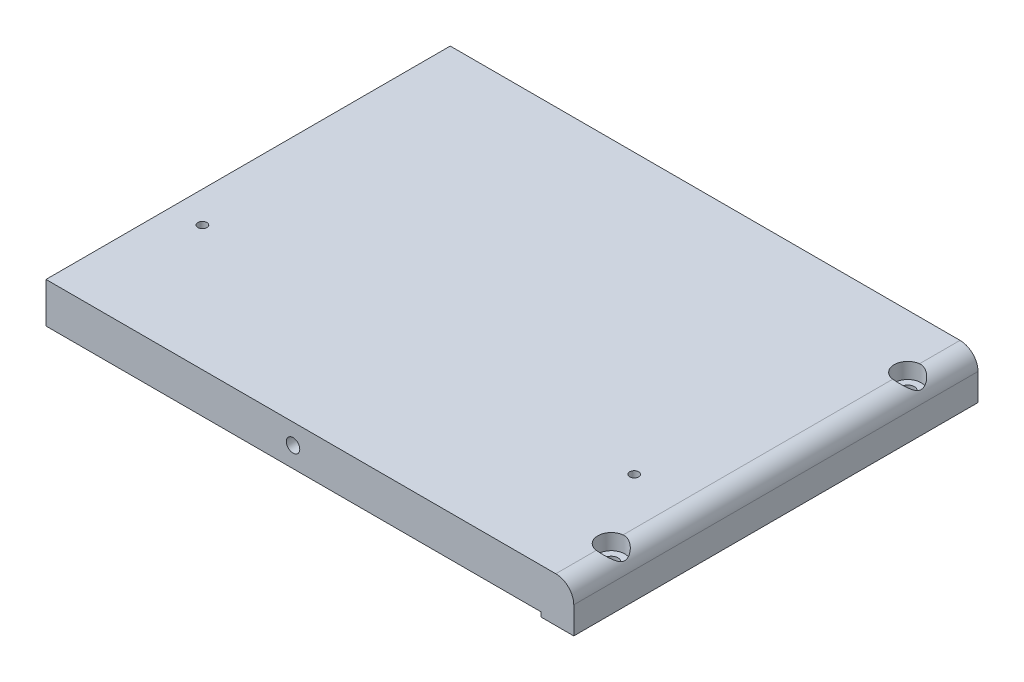
from build123d import *

# Parameters (mm, degrees)
SKETCH_1_W          = 125
SKETCH_1_H          = 70
EXTRUDE_1_DEPTH     = 5
SKETCH_2_W          = 7.5
SKETCH_2_H          = 5
CUT_EXTRUDE_1_DEPTH = 70
EXTRUDE_START       = -70
EXTRUDE_2_DEPTH     = 70
CUT_EXTRUDE_2_REACH = 145.713
SKETCH_5_R          = 11.2
EXTRUDE_3_DEPTH     = 20
SKETCH_7_R          = 1.5
CUT_EXTRUDE_3_DEPTH = 10
CUT_EXTRUDE_4_REACH = 146.193
SKETCH_8_R          = 1.5
SKETCH_9_R          = 3
SKETCH_9_R_2        = 1.5
CUT_EXTRUDE_5_DEPTH = 3.5
SKETCH_11_R         = 1.5
CUT_EXTRUDE_6_DEPTH = 10
CUT_EXTRUDE_7_REACH = 146.193
SKETCH_12_R         = 1
FILLET_1_R          = 4
SKETCH_14_R         = 1.5
CUT_EXTRUDE_8_DEPTH = 10


# Read off the part's stored shape, not the designer's step: 凸台-拉伸2
with BuildPart() as part:
    # 草图1 → 凸台-拉伸1 (new body)
    with BuildSketch(Plane(origin=(0, 0, 0), x_dir=(1, 0, 0), z_dir=(0, 1, 0))):
        with Locations((62.5, 35)):
            Rectangle(SKETCH_1_W, SKETCH_1_H)
    extrude(amount=EXTRUDE_1_DEPTH)

    # 草图2 → 切除-拉伸1 (cut)
    with BuildSketch(Plane.XY):
        with Locations((3.75, 2.5)):
            Rectangle(SKETCH_2_W, SKETCH_2_H)
    extrude(amount=-CUT_EXTRUDE_1_DEPTH, mode=Mode.SUBTRACT)

    # 凸台-拉伸2 outline → 凸台-拉伸2 (add)
    with BuildSketch(Plane.XY.offset(EXTRUDE_START)):
        with BuildLine():
            Line((125, -5), (125, 0))
            Line((125, 0), (7.5, 0))
            Line((7.5, 0), (7.500013395, -11.329987981))
            Line((7.500013395, -11.329987981), (8.200014526, -11.329987981))
            ThreePointArc((8.200014526, -11.329987981), (18.500017961, -4.191325734), (28.800021395, -11.329987981))
            Line((28.800021395, -11.329987981), (30.200014526, -11.329987981))
            ThreePointArc((30.200014526, -11.329987981), (40.500017961, -4.191325734), (50.800021395, -11.329987981))
            Line((50.800021395, -11.329987981), (52.200014526, -11.329987981))
            ThreePointArc((52.200014526, -11.329987981), (62.500017961, -4.191325734), (72.800021395, -11.329987981))
            Line((72.800021395, -11.329987981), (74.200014526, -11.329987981))
            ThreePointArc((74.200014526, -11.329987981), (84.500017961, -4.191325734), (94.800021395, -11.329987981))
            Line((94.800021395, -11.329987981), (96.200014526, -11.329987981))
            ThreePointArc((96.200014526, -11.329987981), (102.083615638, -5.116833662), (110.639689418, -5))
            Line((110.639689418, -5), (125, -5))
        make_face()
    extrude(amount=EXTRUDE_2_DEPTH)

    # 草图5 → 切除-拉伸2 (cut, up to next)
    with BuildSketch(Plane.XY, mode=Mode.PRIVATE) as cut_extrude_2_sk1:
        with Locations((18.500017961, -15.191325734)):
            Circle(SKETCH_5_R)
    cut_extrude_2_tool1 = extrude(cut_extrude_2_sk1.sketch, amount=-CUT_EXTRUDE_2_REACH, mode=Mode.PRIVATE) & part.part
    # 草图5 → 切除-拉伸2 (cut, up to next)
    with BuildSketch(Plane.XY, mode=Mode.PRIVATE) as cut_extrude_2_sk2:
        with Locations((40.500017961, -15.191325734)):
            Circle(SKETCH_5_R)
    cut_extrude_2_tool2 = extrude(cut_extrude_2_sk2.sketch, amount=-CUT_EXTRUDE_2_REACH, mode=Mode.PRIVATE) & part.part
    # 草图5 → 切除-拉伸2 (cut, up to next)
    with BuildSketch(Plane.XY, mode=Mode.PRIVATE) as cut_extrude_2_sk3:
        with Locations((62.500017961, -15.191325734)):
            Circle(SKETCH_5_R)
    cut_extrude_2_tool3 = extrude(cut_extrude_2_sk3.sketch, amount=-CUT_EXTRUDE_2_REACH, mode=Mode.PRIVATE) & part.part
    # 草图5 → 切除-拉伸2 (cut, up to next)
    with BuildSketch(Plane.XY, mode=Mode.PRIVATE) as cut_extrude_2_sk4:
        with Locations((84.500017961, -15.191325734)):
            Circle(SKETCH_5_R)
    cut_extrude_2_tool4 = extrude(cut_extrude_2_sk4.sketch, amount=-CUT_EXTRUDE_2_REACH, mode=Mode.PRIVATE) & part.part
    # 草图5 → 切除-拉伸2 (cut, up to next)
    with BuildSketch(Plane.XY, mode=Mode.PRIVATE) as cut_extrude_2_sk5:
        with Locations((106.500017961, -15.191325734)):
            Circle(SKETCH_5_R)
    cut_extrude_2_tool5 = extrude(cut_extrude_2_sk5.sketch, amount=-CUT_EXTRUDE_2_REACH, mode=Mode.PRIVATE) & part.part
    add(cut_extrude_2_tool1.solids().sort_by_distance((18.500018, -15.191326, 0))[0], mode=Mode.SUBTRACT)
    add(cut_extrude_2_tool2.solids().sort_by_distance((40.500018, -15.191326, 0))[0], mode=Mode.SUBTRACT)
    add(cut_extrude_2_tool3.solids().sort_by_distance((62.500018, -15.191326, 0))[0], mode=Mode.SUBTRACT)
    add(cut_extrude_2_tool4.solids().sort_by_distance((84.500018, -15.191326, 0))[0], mode=Mode.SUBTRACT)
    add(cut_extrude_2_tool5.solids().sort_by_distance((106.500018, -15.191326, 0))[0], mode=Mode.SUBTRACT)

    # 草图6 → 凸台-拉伸3 (add)
    with BuildSketch(Plane.XY):
        Polygon((7.5, 5), (125, 5), (125, -3.991325734), (125, -5), (117.700017961, -5), (117.700017961, -3.991325734), (7.5, -3.991325734), align=None)
    extrude(amount=EXTRUDE_3_DEPTH)

    # 草图7 → 切除-拉伸3 (cut)
    with BuildSketch(Plane(origin=(0, 0, -70), x_dir=(-1, 0, 0), z_dir=(0, 0, -1))):
        with Locations((-29.49999102, -1)):
            Circle(SKETCH_7_R)
        with Locations((-95.50000898, -1)):
            Circle(SKETCH_7_R)
    extrude(amount=-CUT_EXTRUDE_3_DEPTH, mode=Mode.SUBTRACT)

    # 草图8 → 切除-拉伸4 (cut, up to next)
    with BuildSketch(Plane(origin=(0, 5, 0), x_dir=(1, 0, 0), z_dir=(0, 1, 0)), mode=Mode.PRIVATE) as cut_extrude_4_sk1:
        with Locations(Location((121.35000898, 58, 0), (0, 0, 270))):
            Circle(SKETCH_8_R)
    cut_extrude_4_tool1 = extrude(cut_extrude_4_sk1.sketch, amount=-CUT_EXTRUDE_4_REACH, mode=Mode.PRIVATE) & part.part
    # 草图8 → 切除-拉伸4 (cut, up to next)
    with BuildSketch(Plane(origin=(0, 5, 0), x_dir=(1, 0, 0), z_dir=(0, 1, 0)), mode=Mode.PRIVATE) as cut_extrude_4_sk2:
        with Locations(Location((121.35000898, -8, 0), (0, 0, 270))):
            Circle(SKETCH_8_R)
    cut_extrude_4_tool2 = extrude(cut_extrude_4_sk2.sketch, amount=-CUT_EXTRUDE_4_REACH, mode=Mode.PRIVATE) & part.part
    add(cut_extrude_4_tool1.solids().sort_by_distance((121.350009, 5, -58))[0], mode=Mode.SUBTRACT)
    add(cut_extrude_4_tool2.solids().sort_by_distance((121.350009, 5, 8))[0], mode=Mode.SUBTRACT)

    # 草图9 → 切除-拉伸5 (cut)
    # profile 1 of 2: a face of its own
    with BuildSketch(Plane(origin=(0, 5, 0), x_dir=(1, 0, 0), z_dir=(0, 1, 0))):
        with Locations(Location((121.35000898, 58, 0), (0, 0, 270))):
            Circle(SKETCH_9_R)
        with Locations(Location((121.35000898, 58, 0), (0, 0, 270))):
            Circle(SKETCH_9_R_2, mode=Mode.SUBTRACT)
    # profile 2 of 2: a face of its own
    with BuildSketch(Plane(origin=(0, 5, 0), x_dir=(1, 0, 0), z_dir=(0, 1, 0))):
        with Locations(Location((121.35000898, -8, 0), (0, 0, 270))):
            Circle(SKETCH_9_R)
        with Locations(Location((121.35000898, -8, 0), (0, 0, 270))):
            Circle(SKETCH_9_R_2, mode=Mode.SUBTRACT)
    extrude(amount=-CUT_EXTRUDE_5_DEPTH, mode=Mode.SUBTRACT)

    # 草图11 → 切除-拉伸6 (cut)
    with BuildSketch(Plane.ZY.offset(-7.5)):
        with Locations((8, 0.504337133)):
            Circle(SKETCH_11_R)
        with Locations((-58, 0.504337133)):
            Circle(SKETCH_11_R)
    extrude(amount=-CUT_EXTRUDE_6_DEPTH, mode=Mode.SUBTRACT)

    # 草图12 → 切除-拉伸7 (cut, up to next)
    with BuildSketch(Plane(origin=(0, 5, 0), x_dir=(1, 0, 0), z_dir=(0, 1, 0)), mode=Mode.PRIVATE) as cut_extrude_7_sk1:
        with Locations(Location((110.558, 7.891, 0), (0, 0, 270))):
            Circle(SKETCH_12_R)
    cut_extrude_7_tool1 = extrude(cut_extrude_7_sk1.sketch, amount=-CUT_EXTRUDE_7_REACH, mode=Mode.PRIVATE) & part.part
    # 草图12 → 切除-拉伸7 (cut, up to next)
    with BuildSketch(Plane(origin=(0, 5, 0), x_dir=(1, 0, 0), z_dir=(0, 1, 0)), mode=Mode.PRIVATE) as cut_extrude_7_sk2:
        with Locations(Location((14.434, 7.891, 0), (0, 0, 270))):
            Circle(SKETCH_12_R)
    cut_extrude_7_tool2 = extrude(cut_extrude_7_sk2.sketch, amount=-CUT_EXTRUDE_7_REACH, mode=Mode.PRIVATE) & part.part
    add(cut_extrude_7_tool1.solids().sort_by_distance((110.558, 5, -7.891))[0], mode=Mode.SUBTRACT)
    add(cut_extrude_7_tool2.solids().sort_by_distance((14.434, 5, -7.891))[0], mode=Mode.SUBTRACT)

    # 圆角1
    # the kernel refuses this fillet: 4 mm, written as the material it takes off along each edge
    with BuildSketch(Plane(origin=(125, 5, -80), x_dir=(0, -1, 0), z_dir=(0, 0, 1))) as fillet_1_piece_1:
        with BuildLine():
            CenterArc((FILLET_1_R, -FILLET_1_R), FILLET_1_R, 90, 90)
            Line((0, -FILLET_1_R), (0, 0))
            Line((0, 0), (FILLET_1_R, 0))
        make_face()
    extrude(amount=110, mode=Mode.SUBTRACT)

    # 草图14 → 切除-拉伸8 (cut)
    with BuildSketch(Plane.XY.offset(20)):
        with Locations((62.5, 0.504337133)):
            Circle(SKETCH_14_R)
    extrude(amount=-CUT_EXTRUDE_8_DEPTH, mode=Mode.SUBTRACT)


solid = part.part
